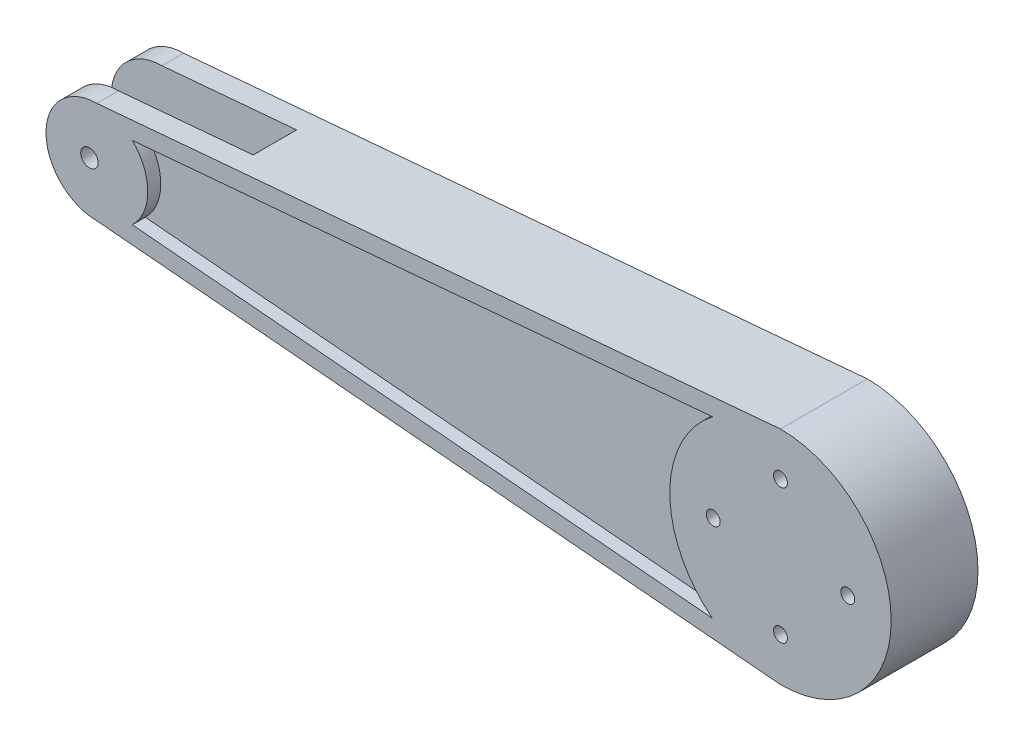
from build123d import *

# Parameters (mm, degrees)
SKETCH1_R               = 1.6
BOSS_EXTRUDE1_DEPTH     = 20
CUT_EXTRUDE1_DEPTH      = 5
CUT_EXTRUDE1_DEPTH_BACK = 5
CUT_EXTRUDE2_START      = -3
CUT_EXTRUDE2_DEPTH      = 3


with BuildPart() as part:
    # Sketch1 → Boss-Extrude1 (new body)
    with BuildSketch(Plane(origin=(0, 0, 0), x_dir=(-1, 0, 0), z_dir=(0, 0, 1))):
        with BuildLine():
            Line((194.706847825, 0), (186.706847825, 0))
            ThreePointArc((186.706847825, 0), (184.706847825, 2), (182.706847825, 0))
            Line((182.706847825, 0), (161.717519891, 0))
            Line((161.717519891, 0), (42.6, 0))
            ThreePointArc((42.6, 0), (41, 1.6), (39.4, 0))
            Line((39.4, 0), (11.6, 0))
            ThreePointArc((11.6, 0), (10, 1.6), (8.4, 0))
            Line((8.4, 0), (0, 0))
            ThreePointArc((0, 0), (7.46877708, 18.03122292), (25.5, 25.5))
            Line((25.5, 25.5), (182.985, 11.721847825))
            ThreePointArc((182.985, 11.721847825), (191.273598085, 8.288598085), (194.706847825, 0))
        make_face()
        with Locations((25.5, 15.5)):
            Circle(SKETCH1_R, mode=Mode.SUBTRACT)
    boss_extrude1 = extrude(amount=BOSS_EXTRUDE1_DEPTH)

    # Mirror1: Boss-Extrude1 across plane
    add(boss_extrude1.mirror(Plane(origin=(0, 0, 20), x_dir=(0, 0, 1), z_dir=(0, -1, 0))))

    # Sketch2 → Cut-Extrude1 (cut, two sides: drawn at the far end of the back side and taken through both)
    with BuildSketch(Plane.XY.offset(10).offset(-CUT_EXTRUDE1_DEPTH_BACK)):
        with BuildLine():
            Line((-151.972734329, -14.435069501), (-151.972734329, 14.435069501))
            Line((-151.972734329, 14.435069501), (-182.985, 11.721847825))
            ThreePointArc((-182.985, 11.721847825), (-194.706847825, 0), (-182.985, -11.721847825))
            Line((-182.985, -11.721847825), (-151.972734329, -14.435069501))
        make_face()
    extrude(amount=CUT_EXTRUDE1_DEPTH + CUT_EXTRUDE1_DEPTH_BACK, mode=Mode.SUBTRACT)

    # Sketch3 → Cut-Extrude2 (cut)
    with BuildSketch(Plane.XY.offset(20).offset(CUT_EXTRUDE2_START)):
        with BuildLine():
            Line((-174.829963862, 8.420041687), (-41.174931587, 20.113341834))
            ThreePointArc((-41.174931587, 20.113341834), (-51, 0), (-41.174931587, -20.113341834))
            Line((-41.174931587, -20.113341834), (-174.829963862, -8.420041687))
            ThreePointArc((-174.829963862, -8.420041687), (-171.263152175, 0), (-174.829963862, 8.420041687))
        make_face()
    cut_extrude2 = extrude(amount=CUT_EXTRUDE2_DEPTH, mode=Mode.SUBTRACT)

    # Mirror2: Cut-Extrude2 across plane
    add(cut_extrude2.mirror(Plane.XY.offset(10)), mode=Mode.SUBTRACT)


solid = part.part
